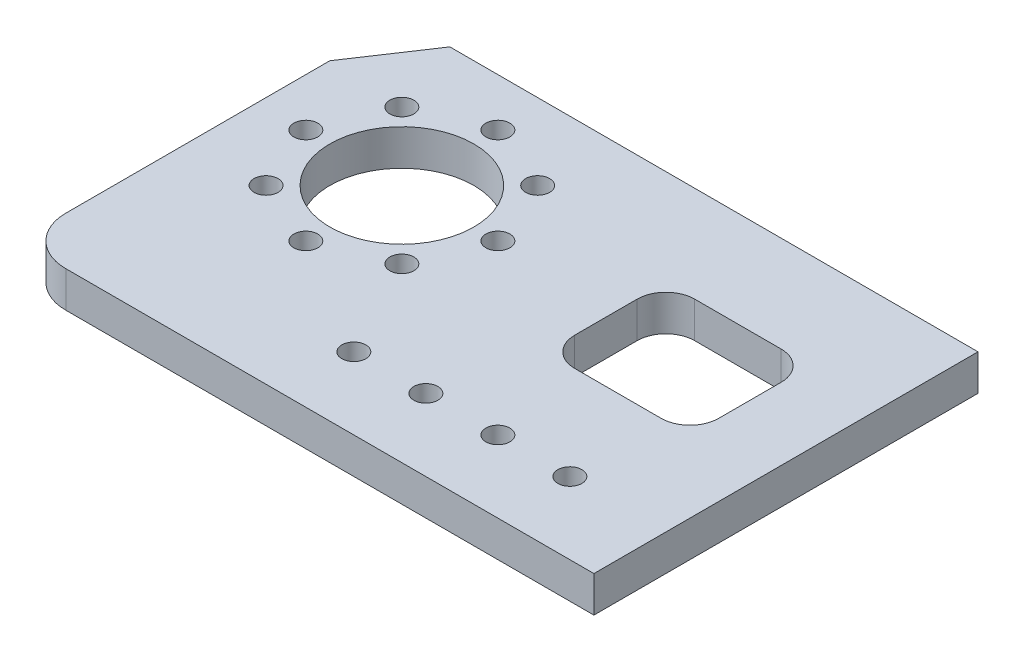
from build123d import *

# Parameters (mm, degrees)
SKETCH1_R           = 19.05
SKETCH1_R_2         = 3.175
BOSS_EXTRUDE1_DEPTH = 9.525


with BuildPart() as part:
    # Sketch1 → Boss-Extrude1 (new body)
    with BuildSketch(Plane(origin=(0, 0, 0), x_dir=(1, 0, 0), z_dir=(0, 1, 0))):
        with BuildLine():
            Line((0, -19.05), (12.7, 0))
            Line((12.7, 0), (152.4, 0))
            Line((152.4, 0), (152.4, -101.6))
            Line((152.4, -101.6), (12.7, -101.6))
            ThreePointArc((12.7, -101.6), (3.719743879, -97.880256121), (0, -88.9))
            Line((0, -88.9), (0, -19.05))
        make_face()
        with Locations((38.1, -38.1)):
            Circle(SKETCH1_R, mode=Mode.SUBTRACT)
        with Locations((56.060512242, -56.060512242)):
            Circle(SKETCH1_R_2, mode=Mode.SUBTRACT)
        with Locations((38.1, -63.5)):
            Circle(SKETCH1_R_2, mode=Mode.SUBTRACT)
        with Locations((20.139487758, -56.060512242)):
            Circle(SKETCH1_R_2, mode=Mode.SUBTRACT)
        with Locations((12.7, -38.1)):
            Circle(SKETCH1_R_2, mode=Mode.SUBTRACT)
        with Locations((20.139487758, -20.139487758)):
            Circle(SKETCH1_R_2, mode=Mode.SUBTRACT)
        with Locations((38.1, -12.7)):
            Circle(SKETCH1_R_2, mode=Mode.SUBTRACT)
        with Locations((56.060512242, -20.139487758)):
            Circle(SKETCH1_R_2, mode=Mode.SUBTRACT)
        with Locations((63.5, -38.1)):
            Circle(SKETCH1_R_2, mode=Mode.SUBTRACT)
        with Locations((69.85, -82.55)):
            Circle(SKETCH1_R_2, mode=Mode.SUBTRACT)
        with Locations((88.9, -82.55)):
            Circle(SKETCH1_R_2, mode=Mode.SUBTRACT)
        with Locations((107.95, -82.55)):
            Circle(SKETCH1_R_2, mode=Mode.SUBTRACT)
        with Locations((127, -82.55)):
            Circle(SKETCH1_R_2, mode=Mode.SUBTRACT)
        with BuildLine():
            Line((102.87, -25.4), (125.73, -25.4))
            ThreePointArc((125.73, -25.4), (131.118153673, -27.631846327), (133.35, -33.02))
            Line((133.35, -33.02), (133.35, -49.53))
            ThreePointArc((133.35, -49.53), (131.118153673, -54.918153673), (125.73, -57.15))
            Line((125.73, -57.15), (102.87, -57.15))
            ThreePointArc((102.87, -57.15), (97.481846327, -54.918153673), (95.25, -49.53))
            Line((95.25, -49.53), (95.25, -33.02))
            ThreePointArc((95.25, -33.02), (97.481846327, -27.631846327), (102.87, -25.4))
        make_face(mode=Mode.SUBTRACT)
    extrude(amount=BOSS_EXTRUDE1_DEPTH)


solid = part.part
